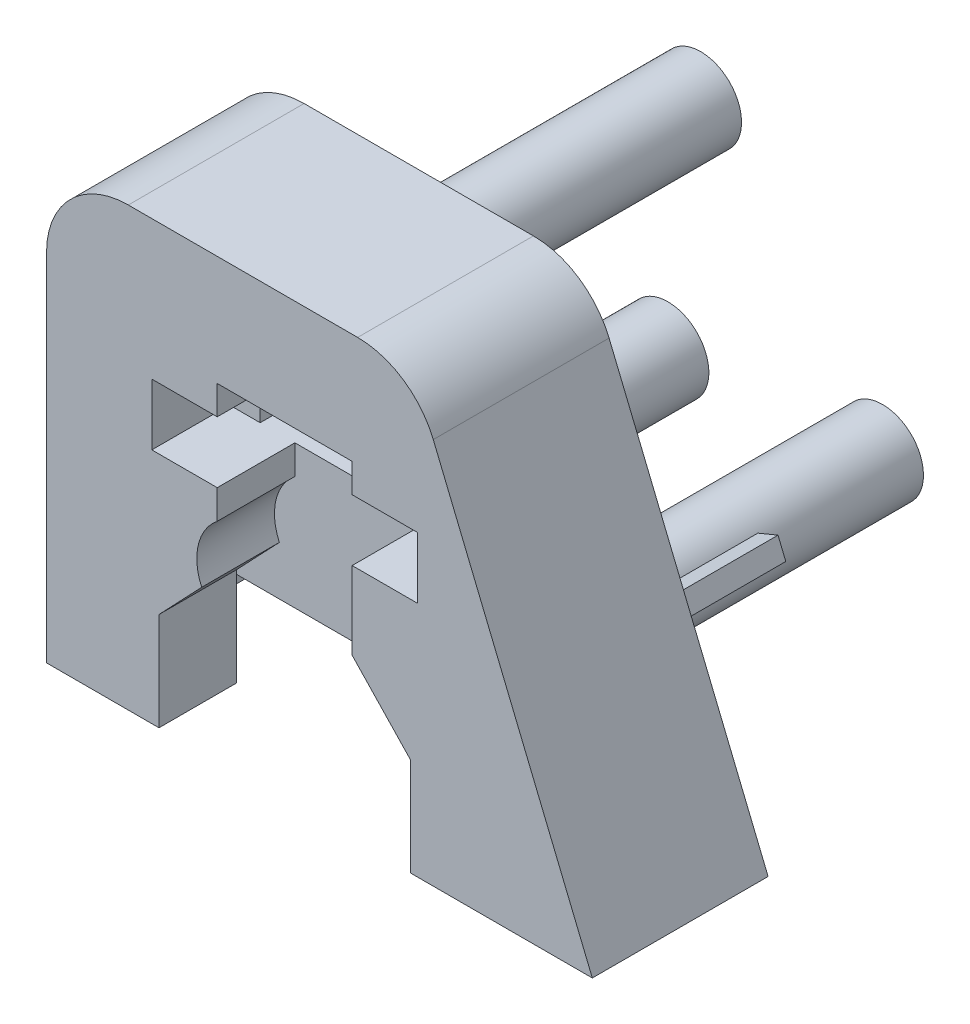
from build123d import *

# Parameters (mm, degrees)
SKETCH1_W           = 17.9
SKETCH1_H           = 21.4
SKETCH1_R           = 1
BOSS_EXTRUDE1_DEPTH = 8.6
FILLET1_R           = 4
SKETCH2_R           = 2
CUT_EXTRUDE1_DEPTH  = 1.8
CUT_EXTRUDE2_START  = -3.8
SKETCH4_R           = 2.65
SKETCH4_W           = 6.6
SKETCH4_H           = 3.8
SKETCH4_W_2         = 12.3
SKETCH4_H_2         = 4.8
CUT_EXTRUDE2_DEPTH  = 3.8
SKETCH5_W           = 10
SKETCH5_H           = 3
CUT_EXTRUDE3_DEPTH  = 22.27422149
CUT_EXTRUDE4_START  = -1.9
SKETCH6_R           = 1
CUT_EXTRUDE4_DEPTH  = 1.9
SKETCH7_W           = 20.5
SKETCH7_H           = 4.6
CUT_EXTRUDE5_DEPTH  = 4.8
SKETCH9_W           = 6.6
SKETCH9_H           = 5
CUT_EXTRUDE6_DEPTH  = 1
SKETCH3_R           = 2
CUT_EXTRUDE7_DEPTH  = 7.4
SKETCH10_R          = 3
BOSS_EXTRUDE2_DEPTH = 4.8
SKETCH11_R          = 2
CUT_EXTRUDE8_DEPTH  = 12.2
SHELL1_START        = -6.688730163
SHELL1_DEPTH        = 6.688730163
SHELL1_START_2      = -3.6
SHELL1_2_OUTLINE_W  = 1.5
SHELL1_2_OUTLINE_H  = 5.4
SHELL1_2_DEPTH      = 3.6
SHELL1_START_3      = -7.4
SHELL1_3_DEPTH      = 1.4
SHELL1_START_4      = -1.7
SHELL1_4_DEPTH      = 1.7
SHELL1_5_DEPTH      = 0.711269837
SHELL1_START_5      = -7.333566942
SHELL1_6_DEPTH      = 0.644836779
SHELL1_START_6      = 3.274859546
SHELL1_7_DEPTH      = 3.925140454
SHELL1_START_7      = -1.8
SHELL1_8_DEPTH      = 0.435460706
CUT_EXTRUDE9_START  = -3.6
CUT_EXTRUDE9_DEPTH  = 3.6
CUT_EXTRUDE10_START = -1.7
CUT_EXTRUDE10_DEPTH = 1.7
BOSS_EXTRUDE3_DEPTH = 1.2
SKETCH18_R          = 2
BOSS_EXTRUDE4_DEPTH = 20.8
SKETCH19_R          = 2
BOSS_EXTRUDE5_DEPTH = 15.4
SKETCH20_R          = 2
BOSS_EXTRUDE6_DEPTH = 20.1
CUT_EXTRUDE11_START = -4.8
SKETCH21_R          = 3
SKETCH21_R_2        = 2
CUT_EXTRUDE11_DEPTH = 4.8
BOSS_EXTRUDE7_DEPTH = 5
BOSS_EXTRUDE8_START = -7
SKETCH23_W          = 3.1
SKETCH23_H          = 0.7
BOSS_EXTRUDE8_DEPTH = 7
CUT_EXTRUDE12_REACH = 32.225
SKETCH24_R          = 1
SKETCH25_R          = 1
BOSS_EXTRUDE9_DEPTH = 1.2


with BuildPart() as part:
    # Sketch1 → Boss-Extrude1 (new body)
    # profile 1 of 2: a face of its own
    with BuildSketch(Plane.XY):
        Rectangle(SKETCH1_W, SKETCH1_H)
        with Locations((1.05, -2.6)):
            Circle(SKETCH1_R, mode=Mode.SUBTRACT)
    # profile 2 of 2: a face of its own
    with BuildSketch(Plane.XY):
        Polygon((17.75, -10.7), (8.95, -10.7), (8.95, 10.7), align=None)
    extrude(amount=-BOSS_EXTRUDE1_DEPTH)

    # Fillet1
    fillet1_edges = [part.edges().sort_by_distance(p)[0] for p in [
        (-8.95, 10.7, -4.3),
        (8.95, 10.7, -4.3),
    ]]
    fillet(fillet1_edges, radius=FILLET1_R)

    # Sketch2 → Cut-Extrude1 (cut)
    with BuildSketch(Plane.XY):
        with Locations((1.05, -2.6)):
            Circle(SKETCH2_R)
    extrude(amount=-CUT_EXTRUDE1_DEPTH, mode=Mode.SUBTRACT)

    # Sketch4 → Cut-Extrude2 (cut)
    with BuildSketch(Plane(origin=(0, 0, -8.6), x_dir=(-1, 0, 0), z_dir=(0, 0, -1)).offset(CUT_EXTRUDE2_START)):
        Polygon((-9.2, 0.9), (-6, 0.9), (0.6, 0.9), (3.8, 0.9), (3.8, 3.9), (-9.2, 3.9), align=None)
        with Locations((-1.05, -2.6)):
            Circle(SKETCH4_R)
        with Locations((-2.7, -1)):
            Rectangle(SKETCH4_W, SKETCH4_H)
        with BuildLine():
            ThreePointArc((0.6, -0.526355865), (-2.334562661, -0.28215644), (-3.682964109, -2.9))
            Line((-3.682964109, -2.9), (-2.003939201, -2.9))
            ThreePointArc((-2.003939201, -2.9), (-1.201757699, -1.611582274), (-0.05, -2.6))
            ThreePointArc((-0.05, -2.6), (-0.061582274, -2.751757699), (-0.096060799, -2.9))
            Line((-0.096060799, -2.9), (0.6, -2.9))
            Line((0.6, -2.9), (0.6, -0.526355865))
        make_face()
        with BuildLine():
            Line((-2.003939201, -2.9), (-3.682964109, -2.9))
            ThreePointArc((-3.682964109, -2.9), (-1.465474787, -5.217227675), (1.360616498, -3.700648945))
            Line((1.360616498, -3.700648945), (0.6, -2.9))
            Line((0.6, -2.9), (-0.096060799, -2.9))
            ThreePointArc((-0.096060799, -2.9), (-1.05, -3.6), (-2.003939201, -2.9))
        make_face()
        with BuildLine():
            Line((0.6, -2.9), (1.360616498, -3.700648945))
            ThreePointArc((1.360616498, -3.700648945), (1.539462658, -3.163190146), (1.6, -2.6))
            ThreePointArc((1.6, -2.6), (1.336943652, -1.448913557), (0.6, -0.526355865))
            Line((0.6, -0.526355865), (0.6, -2.9))
        make_face()
        Polygon((-6, -2.9), (0.6, -2.9), (3.45, -5.9), (-8.85, -5.9), align=None)
        with Locations((-2.7, -8.3)):
            Rectangle(SKETCH4_W_2, SKETCH4_H_2)
    extrude(amount=CUT_EXTRUDE2_DEPTH, mode=Mode.SUBTRACT)

    # Sketch5 → Cut-Extrude3 (cut, through all)
    with BuildSketch(Plane(origin=(0, 0, -4.8), x_dir=(-1, 0, 0), z_dir=(0, 0, -1))):
        with Locations((-2.7, 2.4)):
            Rectangle(SKETCH5_W, SKETCH5_H)
    extrude(amount=-CUT_EXTRUDE3_DEPTH, mode=Mode.SUBTRACT)

    # Sketch6 → Cut-Extrude4 (cut)
    # profile 1 of 5: a face of its own
    with BuildSketch(Plane(origin=(0, 0, -4.8), x_dir=(-1, 0, 0), z_dir=(0, 0, -1)).offset(CUT_EXTRUDE4_START)):
        with BuildLine():
            ThreePointArc((-2.6, -0.450581474), (-3.7, -2.6), (-2.6, -4.749418526))
            Line((-2.6, -4.749418526), (-2.6, -0.450581474))
        make_face()
    # profile 2 of 5: a face of its own
    with BuildSketch(Plane(origin=(0, 0, -4.8), x_dir=(-1, 0, 0), z_dir=(0, 0, -1)).offset(CUT_EXTRUDE4_START)):
        with BuildLine():
            Line((-2.6, -0.450581474), (-2.6, -4.749418526))
            ThreePointArc((-2.6, -4.749418526), (-1.05, -5.25), (0.5, -4.749418526))
            Line((0.5, -4.749418526), (0.5, -0.450581474))
            ThreePointArc((0.5, -0.450581474), (-1.05, 0.05), (-2.6, -0.450581474))
        make_face()
        with Locations(Location((-1.05, -2.6, 0), (0, 0, 180))):
            Circle(SKETCH6_R, mode=Mode.SUBTRACT)
    # profile 3 of 5: a face of its own
    with BuildSketch(Plane(origin=(0, 0, -4.8), x_dir=(-1, 0, 0), z_dir=(0, 0, -1)).offset(CUT_EXTRUDE4_START)):
        with BuildLine():
            Line((-2.6, 0.9), (-2.6, -0.450581474))
            ThreePointArc((-2.6, -0.450581474), (-1.05, 0.05), (0.5, -0.450581474))
            Line((0.5, -0.450581474), (0.5, 0.9))
            Line((0.5, 0.9), (-2.6, 0.9))
        make_face()
    # profile 4 of 5: a face of its own
    with BuildSketch(Plane(origin=(0, 0, -4.8), x_dir=(-1, 0, 0), z_dir=(0, 0, -1)).offset(CUT_EXTRUDE4_START)):
        with BuildLine():
            Line((0.5, -0.450581474), (0.5, -4.749418526))
            ThreePointArc((0.5, -4.749418526), (0.998560511, -4.281041294), (1.360616498, -3.700648945))
            ThreePointArc((1.360616498, -3.700648945), (1.539462658, -3.163190146), (1.6, -2.6))
            ThreePointArc((1.6, -2.6), (1.336943652, -1.448913557), (0.6, -0.526355865))
            ThreePointArc((0.6, -0.526355865), (0.550448512, -0.487876765), (0.5, -0.450581474))
        make_face()
    # profile 5 of 5: a face of its own
    with BuildSketch(Plane(origin=(0, 0, -4.8), x_dir=(-1, 0, 0), z_dir=(0, 0, -1)).offset(CUT_EXTRUDE4_START)):
        with BuildLine():
            Line((-2.6, -4.749418526), (-2.6, -6.1))
            Line((-2.6, -6.1), (0.5, -6.1))
            Line((0.5, -6.1), (0.5, -4.749418526))
            ThreePointArc((0.5, -4.749418526), (-1.05, -5.25), (-2.6, -4.749418526))
        make_face()
    extrude(amount=CUT_EXTRUDE4_DEPTH, mode=Mode.SUBTRACT)

    # Sketch7 → Cut-Extrude5 (cut)
    with BuildSketch(Plane.XY):
        with Locations((2.6, -8.4)):
            Rectangle(SKETCH7_W, SKETCH7_H)
    extrude(amount=-CUT_EXTRUDE5_DEPTH, mode=Mode.SUBTRACT)

    # Sketch9 → Cut-Extrude6 (cut)
    with BuildSketch(Plane(origin=(0, -2.35, -2.35), x_dir=(-1, 0, 0), z_dir=(0, -0.7071067811865561, -0.7071067811865389))):
        with Locations((-2.7, 9.217514421)):
            Rectangle(SKETCH9_W, SKETCH9_H)
    extrude(amount=-CUT_EXTRUDE6_DEPTH, mode=Mode.SUBTRACT)

    # Sketch3 → Cut-Extrude7 (cut)
    with BuildSketch(Plane.XY):
        with Locations((1.05, 7.2)):
            Circle(SKETCH3_R)
    extrude(amount=-CUT_EXTRUDE7_DEPTH, mode=Mode.SUBTRACT)

    # Sketch10 → Boss-Extrude2 (add)
    with BuildSketch(Plane.XY):
        with Locations((10.65, -2.6)):
            Circle(SKETCH10_R)
    extrude(amount=BOSS_EXTRUDE2_DEPTH)

    # Sketch11 → Cut-Extrude8 (cut)
    with BuildSketch(Plane.XY.offset(4.8)):
        with Locations((10.65, -2.6)):
            Circle(SKETCH11_R)
    extrude(amount=-CUT_EXTRUDE8_DEPTH, mode=Mode.SUBTRACT)

    # Shell1: read off the stored shape, not the designer's step
    # Shell1 outline → Shell1 (cut)
    with BuildSketch(Plane.XY.offset(SHELL1_START)):
        with BuildLine():
            Line((8.425140454, -0.3), (7.2, -0.3))
            Line((7.2, -0.3), (7.2, -2.420869782))
            Line((7.2, -2.420869782), (7.451135024, -2.685222439))
            ThreePointArc((7.451135024, -2.685222439), (7.687481064, -1.390255582), (8.425140454, -0.3))
        make_face()
        with BuildLine():
            Line((-4.155173707, -4.9), (-2.718545428, -3.387759707))
            ThreePointArc((-2.718545428, -3.387759707), (-2.709630033, -1.770734053), (-2.037474696, -0.3))
            Line((-2.037474696, -0.3), (-5, -0.3))
            Line((-5, -0.3), (-5, 5.1))
            Line((-5, 5.1), (-1.364539294, 5.1))
            ThreePointArc((-1.364539294, 5.1), (-2.147030716, 7.337820904), (-1.174859546, 9.5))
            Line((-1.174859546, 9.5), (-4.95, 9.5))
            ThreePointArc((-4.95, 9.5), (-6.929898987, 8.679898987), (-7.75, 6.7))
            Line((-7.75, 6.7), (-7.75, -4.9))
            Line((-7.75, -4.9), (-4.155173707, -4.9))
        make_face()
        with BuildLine():
            Line((12.874859546, -4.9), (14.05, -4.9))
            Line((14.05, -4.9), (14.05, -9.5))
            Line((14.05, -9.5), (15.959044178, -9.5))
            Line((15.959044178, -9.5), (13.615804478, -3.801667092))
            ThreePointArc((13.615804478, -3.801667092), (13.302797023, -4.389599942), (12.874859546, -4.9))
        make_face()
        with BuildLine():
            ThreePointArc((10.4, 0.590219428), (11.17143883, 0.557230043), (11.912517793, 0.340416437))
            Line((11.912517793, 0.340416437), (10.4, 4.018584707))
            Line((10.4, 4.018584707), (10.4, 0.590219428))
        make_face()
        with BuildLine():
            Line((7.2, 5.1), (9.955305861, 5.1))
            Line((9.955305861, 5.1), (8.859466499, 7.764882083))
            ThreePointArc((8.859466499, 7.764882083), (7.828444792, 9.026120142), (6.269866888, 9.5))
            Line((6.269866888, 9.5), (3.274859546, 9.5))
            ThreePointArc((3.274859546, 9.5), (4.247030716, 7.337820904), (3.464539294, 5.1))
            Line((3.464539294, 5.1), (7.2, 5.1))
        make_face()
    extrude(amount=SHELL1_DEPTH, mode=Mode.SUBTRACT)

    # Shell1 2 outline → Shell1 2 (cut)
    with BuildSketch(Plane.XY.offset(SHELL1_START_2)):
        with BuildLine():
            Line((7.2, -0.3), (4.137474696, -0.3))
            ThreePointArc((4.137474696, -0.3), (4.9, -2.6), (4.137474696, -4.9))
            Line((4.137474696, -4.9), (8.425140454, -4.9))
            ThreePointArc((8.425140454, -4.9), (7.720749783, -3.888213168), (7.451135024, -2.685222439))
            Line((7.451135024, -2.685222439), (7.2, -2.420869782))
            Line((7.2, -2.420869782), (7.2, -0.3))
        make_face()
        with BuildLine():
            Line((-4.155173707, -4.9), (-2.037474696, -4.9))
            ThreePointArc((-2.037474696, -4.9), (-2.460408902, -4.180989987), (-2.718545428, -3.387759707))
            Line((-2.718545428, -3.387759707), (-4.155173707, -4.9))
        make_face()
        with Locations((-4.25, 2.4)):
            Rectangle(SHELL1_2_OUTLINE_W, SHELL1_2_OUTLINE_H)
        with BuildLine():
            ThreePointArc((8.9, 0.079085665), (9.617859297, 0.428974342), (10.4, 0.590219428))
            Line((10.4, 0.590219428), (10.4, 4.018584707))
            Line((10.4, 4.018584707), (9.95530586, 5.1))
            Line((9.95530586, 5.1), (8.9, 5.1))
            Line((8.9, 5.1), (8.9, 0.079085665))
        make_face()
    extrude(amount=SHELL1_2_DEPTH, mode=Mode.SUBTRACT)

    # Shell1 3 outline → Shell1 3 (cut)
    with BuildSketch(Plane.XY.offset(SHELL1_START_3)):
        with BuildLine():
            Line((8.425140454, -0.3), (7.2, -0.3))
            Line((7.2, -0.3), (7.2, -2.420869782))
            Line((7.2, -2.420869782), (7.451135024, -2.685222439))
            ThreePointArc((7.451135024, -2.685222439), (7.687481064, -1.390255582), (8.425140454, -0.3))
        make_face()
        with BuildLine():
            ThreePointArc((-2.718545428, -3.387759707), (-2.709630033, -1.770734053), (-2.037474696, -0.3))
            Line((-2.037474696, -0.3), (-5, -0.3))
            Line((-5, -0.3), (-5, 5.1))
            Line((-5, 5.1), (-1.8, 5.1))
            Line((-1.8, 5.1), (-1.8, 5.744836779))
            ThreePointArc((-1.8, 5.744836779), (-2.106558657, 7.725487814), (-1.174859546, 9.5))
            Line((-1.174859546, 9.5), (-4.95, 9.5))
            ThreePointArc((-4.95, 9.5), (-6.929898987, 8.679898987), (-7.75, 6.7))
            Line((-7.75, 6.7), (-7.75, -9.5))
            Line((-7.75, -9.5), (-4.65, -9.5))
            Line((-4.65, -9.5), (-4.65, -5.420869782))
            Line((-4.65, -5.420869782), (-2.718545428, -3.387759707))
        make_face()
        with BuildLine():
            Line((10.05, -9.5), (15.959044178, -9.5))
            Line((15.959044178, -9.5), (13.615804478, -3.801667092))
            ThreePointArc((13.615804478, -3.801667092), (12.180258337, -5.410393108), (10.05, -5.743246729))
            Line((10.05, -5.743246729), (10.05, -9.5))
        make_face()
        with BuildLine():
            ThreePointArc((10.4, 0.590219428), (11.17143883, 0.557230043), (11.912517793, 0.340416437))
            Line((11.912517793, 0.340416437), (10.4, 4.018584707))
            Line((10.4, 4.018584707), (10.4, 0.590219428))
        make_face()
    extrude(amount=SHELL1_3_DEPTH, mode=Mode.SUBTRACT)

    # Shell1 4 outline → Shell1 4 (cut)
    with BuildSketch(Plane.XY.offset(SHELL1_START_4)):
        with BuildLine():
            ThreePointArc((4.137474696, -4.9), (4.9, -2.6), (4.137474696, -0.3))
            Line((4.137474696, -0.3), (3.274859546, -0.3))
            ThreePointArc((3.274859546, -0.3), (4.25, -2.6), (3.274859546, -4.9))
            Line((3.274859546, -4.9), (4.137474696, -4.9))
        make_face()
        with BuildLine():
            ThreePointArc((-2.037474696, -0.3), (-2.8, -2.6), (-2.037474696, -4.9))
            Line((-2.037474696, -4.9), (-1.174859546, -4.9))
            ThreePointArc((-1.174859546, -4.9), (-2.15, -2.6), (-1.174859546, -0.3))
            Line((-1.174859546, -0.3), (-2.037474696, -0.3))
        make_face()
    extrude(amount=SHELL1_4_DEPTH, mode=Mode.SUBTRACT)

    # Shell1 5 outline → Shell1 5 (cut)
    with BuildSketch(Plane.XY.offset(SHELL1_START_3)):
        with BuildLine():
            Line((9.95530586, 5.1), (8.859466499, 7.764882083))
            ThreePointArc((8.859466499, 7.764882083), (7.828444792, 9.026120142), (6.269866888, 9.5))
            Line((6.269866888, 9.5), (3.274859546, 9.5))
            ThreePointArc((3.274859546, 9.5), (4.247030716, 7.337820904), (3.464539294, 5.1))
            Line((3.464539294, 5.1), (7.2, 5.1))
            Line((7.2, 5.1), (9.95530586, 5.1))
        make_face()
    extrude(amount=SHELL1_5_DEPTH, mode=Mode.SUBTRACT)

    # Shell1 6 outline → Shell1 6 (cut)
    with BuildSketch(Plane.XY.offset(SHELL1_START_5)):
        with BuildLine():
            ThreePointArc((-1.364539294, 5.1), (-1.60194214, 5.409133481), (-1.8, 5.744836779))
            Line((-1.8, 5.744836779), (-1.8, 5.1))
            Line((-1.8, 5.1), (-1.364539294, 5.1))
        make_face()
    extrude(amount=SHELL1_6_DEPTH, mode=Mode.SUBTRACT)

    # Shell1 7 outline → Shell1 7 (add)
    with BuildSketch(Plane.YZ.offset(SHELL1_START_6)):
        Polygon((5.1, -7.4), (5.811269837, -7.4), (5.1, -6.688730163), align=None)
    extrude(amount=SHELL1_7_DEPTH)

    # Shell1 8 outline → Shell1 8 (add)
    with BuildSketch(Plane.YZ.offset(SHELL1_START_7)):
        Polygon((5.1, -7.333566942), (5.744836779, -7.333566942), (5.1, -6.688730163), align=None)
    extrude(amount=SHELL1_8_DEPTH)

    # Cut-Extrude9: read off the stored shape, not the designer's step
    # Cut-Extrude9 outline → Cut-Extrude9 (cut)
    with BuildSketch(Plane.XY.offset(CUT_EXTRUDE9_START)):
        with BuildLine():
            Line((7.7, 0.9), (2.653901493, 0.9))
            ThreePointArc((2.653901493, 0.9), (3.471208921, 0.393367228), (4.137474696, -0.3))
            Line((4.137474696, -0.3), (8.425140454, -0.3))
            ThreePointArc((8.425140454, -0.3), (8.653552258, -0.099160859), (8.9, 0.079085665))
            Line((8.9, 0.079085665), (8.9, 5.1))
            Line((8.9, 5.1), (3.464539294, 5.1))
            ThreePointArc((3.464539294, 5.1), (1.05, 4), (-1.364539294, 5.1))
            Line((-1.364539294, 5.1), (-3.5, 5.1))
            Line((-3.5, 5.1), (-3.5, -0.3))
            Line((-3.5, -0.3), (-2.037474696, -0.3))
            ThreePointArc((-2.037474696, -0.3), (-1.371208921, 0.393367228), (-0.553901493, 0.9))
            Line((-0.553901493, 0.9), (-2.3, 0.9))
            Line((-2.3, 0.9), (-2.3, 3.9))
            Line((-2.3, 3.9), (7.7, 3.9))
            Line((7.7, 3.9), (7.7, 0.9))
        make_face()
    extrude(amount=CUT_EXTRUDE9_DEPTH, mode=Mode.SUBTRACT)

    # Sketch15 → Cut-Extrude10 (cut)
    with BuildSketch(Plane.XY.offset(CUT_EXTRUDE10_START)):
        with BuildLine():
            ThreePointArc((-0.553901493, 0.9), (-1.371208921, 0.393367228), (-2.037474696, -0.3))
            Line((-2.037474696, -0.3), (-1.174859546, -0.3))
            ThreePointArc((-1.174859546, -0.3), (1.05, 0.6), (3.274859546, -0.3))
            Line((3.274859546, -0.3), (4.137474696, -0.3))
            ThreePointArc((4.137474696, -0.3), (3.471208921, 0.393367228), (2.653901493, 0.9))
            Line((2.653901493, 0.9), (-0.553901493, 0.9))
        make_face()
    extrude(amount=CUT_EXTRUDE10_DEPTH, mode=Mode.SUBTRACT)


with BuildPart() as body_2:
    # Mirror1: mirrored copy
    add(part.part.mirror(Plane.XY))

    # Sketch16 → Boss-Extrude3 (add)
    with BuildSketch(Plane.XY.offset(4.8)):
        with BuildLine():
            ThreePointArc((2.6, -0.450581474), (1.05, 0.05), (-0.5, -0.450581474))
            Line((-0.5, -0.450581474), (-0.5, -4.749418526))
            ThreePointArc((-0.5, -4.749418526), (1.05, -5.25), (2.6, -4.749418526))
            Line((2.6, -4.749418526), (2.6, -0.450581474))
        make_face()
        with BuildLine():
            Line((-0.5, -4.749418526), (-0.5, -0.450581474))
            ThreePointArc((-0.5, -0.450581474), (-1.6, -2.6), (-0.5, -4.749418526))
        make_face()
        with BuildLine():
            Line((2.6, 0.9), (-0.5, 0.9))
            Line((-0.5, 0.9), (-0.5, -0.450581474))
            ThreePointArc((-0.5, -0.450581474), (1.05, 0.05), (2.6, -0.450581474))
            Line((2.6, -0.450581474), (2.6, 0.9))
        make_face()
        with BuildLine():
            ThreePointArc((3.7, -2.6), (3.409025222, -1.392730353), (2.6, -0.450581474))
            Line((2.6, -0.450581474), (2.6, -4.749418526))
            ThreePointArc((2.6, -4.749418526), (3.409025222, -3.807269647), (3.7, -2.6))
        make_face()
        with BuildLine():
            ThreePointArc((2.6, -4.749418526), (1.05, -5.25), (-0.5, -4.749418526))
            Line((-0.5, -4.749418526), (-0.5, -6.1))
            Line((-0.5, -6.1), (2.6, -6.1))
            Line((2.6, -6.1), (2.6, -4.749418526))
        make_face()
    extrude(amount=-BOSS_EXTRUDE3_DEPTH)

    # Sketch18 → Boss-Extrude4 (add)
    with BuildSketch(Plane(origin=(0, 0, 7.4), x_dir=(-1, 0, 0), z_dir=(0, 0, -1))):
        with Locations((-1.05, 7.2)):
            Circle(SKETCH18_R)
    extrude(amount=BOSS_EXTRUDE4_DEPTH)

    # Sketch19 → Boss-Extrude5 (add)
    with BuildSketch(Plane(origin=(0, 0, 3.6), x_dir=(-1, 0, 0), z_dir=(0, 0, -1))):
        with Locations(Location((-1.05, -2.6, 0), (0, 0, 180))):
            Circle(SKETCH19_R)
    extrude(amount=BOSS_EXTRUDE5_DEPTH)

    # Sketch20 → Boss-Extrude6 (add)
    with BuildSketch(Plane(origin=(0, 0, 7.4), x_dir=(-1, 0, 0), z_dir=(0, 0, -1))):
        with Locations((-10.65, -2.6)):
            Circle(SKETCH20_R)
    extrude(amount=BOSS_EXTRUDE6_DEPTH)

    # Sketch21 → Cut-Extrude11 (cut)
    with BuildSketch(Plane(origin=(0, 0, -4.8), x_dir=(-1, 0, 0), z_dir=(0, 0, -1)).offset(CUT_EXTRUDE11_START)):
        with Locations((-10.65, -2.6)):
            Circle(SKETCH21_R)
        with Locations((-10.65, -2.6)):
            Circle(SKETCH21_R_2, mode=Mode.SUBTRACT)
    extrude(amount=CUT_EXTRUDE11_DEPTH, mode=Mode.SUBTRACT)

    # Sketch22 → Boss-Extrude7 (add)
    with BuildSketch(Plane(origin=(0, 0, 0), x_dir=(-1, 0, 0), z_dir=(0, 0, -1))):
        Polygon((-13.614728527, -1.921483413), (-10.840157515, -3.062428502), (-10.459842485, -2.137571498), (-13.234413498, -0.996626409), align=None)
    extrude(amount=BOSS_EXTRUDE7_DEPTH)

    # Sketch23 → Boss-Extrude8 (add)
    with BuildSketch(Plane.XZ.offset(6.1).offset(BOSS_EXTRUDE8_START)):
        with Locations((1.05, 3.25)):
            Rectangle(SKETCH23_W, SKETCH23_H)
    extrude(amount=BOSS_EXTRUDE8_DEPTH)

    # Cut-Extrude12: up to this face of the body (flat: up to its plane)
    cut_extrude12_end = Plane(body_2.part.faces().sort_by_distance((6.62629189, 7.340799544, 7.4))[0])
    # Sketch24 → Cut-Extrude12 (cut, up to the picked face)
    with BuildSketch(Plane(origin=(0, 0, -13.4), x_dir=(-1, 0, 0), z_dir=(0, 0, -1)), mode=Mode.PRIVATE) as cut_extrude12_sk1:
        with Locations((-1.05, 7.2)):
            Circle(SKETCH24_R)
    cut_extrude12_tool1 = split(extrude(cut_extrude12_sk1.sketch, amount=-CUT_EXTRUDE12_REACH, mode=Mode.PRIVATE), bisect_by=cut_extrude12_end, keep=Keep.BOTH, mode=Mode.PRIVATE)
    # Sketch24 → Cut-Extrude12 (cut, up to the picked face)
    with BuildSketch(Plane(origin=(0, 0, -13.4), x_dir=(-1, 0, 0), z_dir=(0, 0, -1)), mode=Mode.PRIVATE) as cut_extrude12_sk2:
        with Locations((-1.05, -2.6)):
            Circle(SKETCH24_R)
    cut_extrude12_tool2 = split(extrude(cut_extrude12_sk2.sketch, amount=-CUT_EXTRUDE12_REACH, mode=Mode.PRIVATE), bisect_by=cut_extrude12_end, keep=Keep.BOTH, mode=Mode.PRIVATE)
    # Sketch24 → Cut-Extrude12 (cut, up to the picked face)
    with BuildSketch(Plane(origin=(0, 0, -13.4), x_dir=(-1, 0, 0), z_dir=(0, 0, -1)), mode=Mode.PRIVATE) as cut_extrude12_sk3:
        with Locations((-10.65, -2.6)):
            Circle(SKETCH24_R)
    cut_extrude12_tool3 = split(extrude(cut_extrude12_sk3.sketch, amount=-CUT_EXTRUDE12_REACH, mode=Mode.PRIVATE), bisect_by=cut_extrude12_end, keep=Keep.BOTH, mode=Mode.PRIVATE)
    add(cut_extrude12_tool1.solids().sort_by(Axis((1.05, 7.2, -13.4), (0, 0, 1)))[0], mode=Mode.SUBTRACT)
    add(cut_extrude12_tool2.solids().sort_by(Axis((1.05, -2.6, -13.4), (0, 0, 1)))[0], mode=Mode.SUBTRACT)
    add(cut_extrude12_tool3.solids().sort_by(Axis((10.65, -2.6, -13.4), (0, 0, 1)))[0], mode=Mode.SUBTRACT)

    # Sketch25 → Boss-Extrude9 (add)
    with BuildSketch(Plane.XY.offset(4.8)):
        with Locations(Location((1.05, -2.6, 0), (0, 0, 180))):
            Circle(SKETCH25_R)
    extrude(amount=-BOSS_EXTRUDE9_DEPTH)


solid = body_2.part
